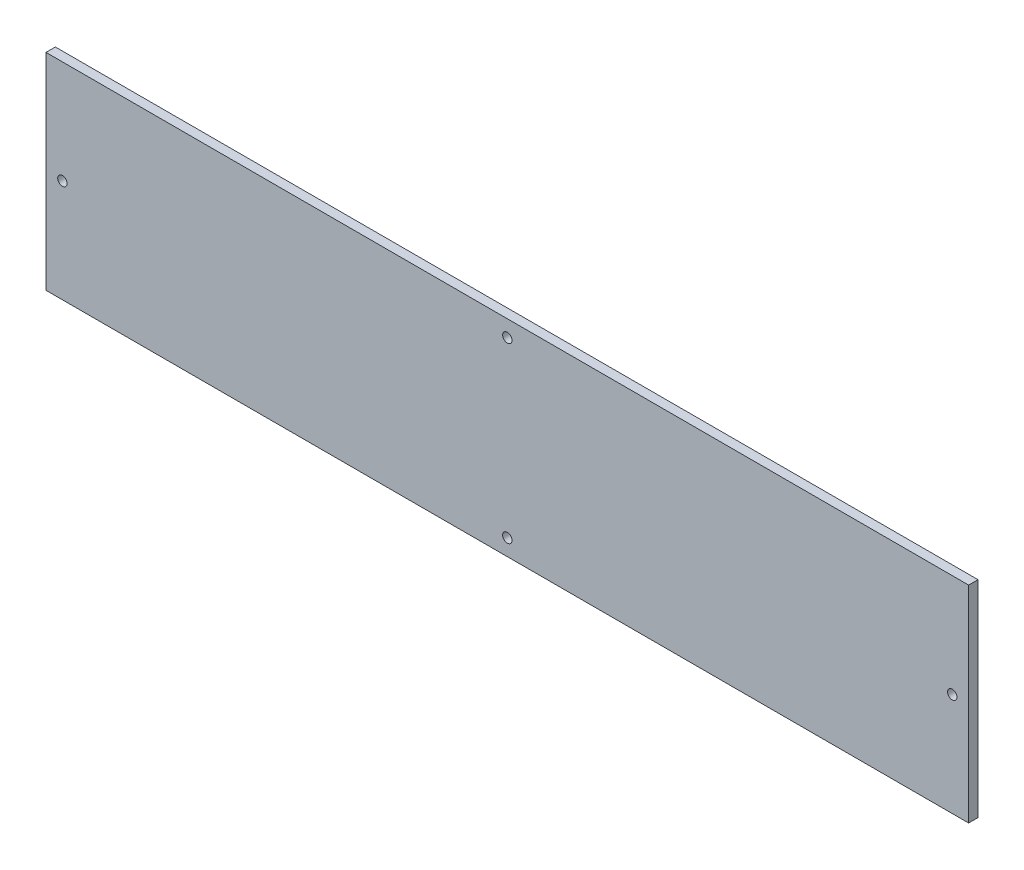
from build123d import *

# Parameters (mm, degrees)
SCHIZZO1_W                   = 394
SCHIZZO1_H                   = 88
SCHIZZO1_R                   = 2
ESTRUSIONE_ESTRUSIONE1_DEPTH = 4


with BuildPart() as part:
    # Schizzo1 → Estrusione-Estrusione1 (new body)
    with BuildSketch(Plane.XY):
        with Locations((-197, 44)):
            Rectangle(SCHIZZO1_W, SCHIZZO1_H)
        with Locations((-7, 44)):
            Circle(SCHIZZO1_R, mode=Mode.SUBTRACT)
        with Locations((-197, 81)):
            Circle(SCHIZZO1_R, mode=Mode.SUBTRACT)
        with Locations((-387, 44)):
            Circle(SCHIZZO1_R, mode=Mode.SUBTRACT)
        with Locations((-197, 7)):
            Circle(SCHIZZO1_R, mode=Mode.SUBTRACT)
    extrude(amount=ESTRUSIONE_ESTRUSIONE1_DEPTH)


solid = part.part
